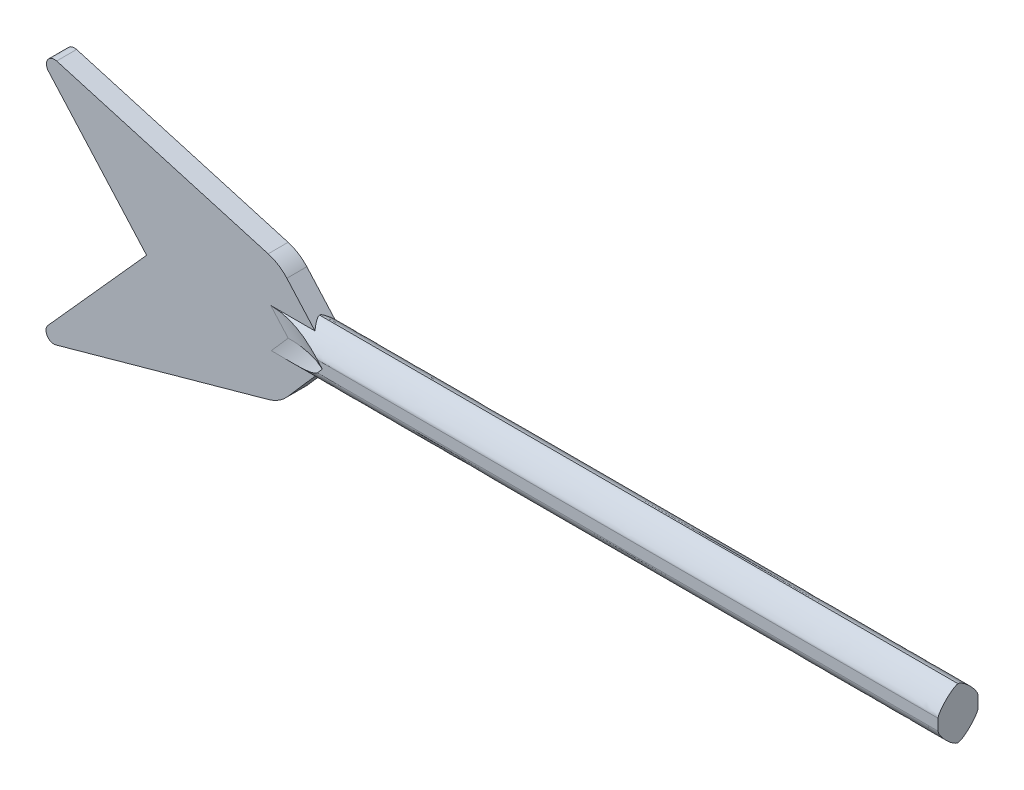
from build123d import *

# Parameters (mm, degrees)
BOSS_EXTRU_1_DEPTH = 5
BOSS_EXTRU_3_START = 7.5
BOSS_EXTRU_3_DEPTH = 10
CONG_8_R           = 15
CONG_9_SIZE        = 5


with BuildPart() as part:
    # Esquisse1 → Boss.-Extru.1 (new body)
    with BuildSketch(Plane.XY):
        with BuildLine():
            Line((-12.455060077, 7.329105625), (-23.832360657, 20.114357067))
            ThreePointArc((-23.832360657, 20.114357067), (-25.968224675, 21.924872738), (-28.522312132, 23.072269514))
            Line((-28.522312132, 23.072269514), (-81.529598126, 38.415853733))
            ThreePointArc((-81.529598126, 38.415853733), (-83.77734848, 37.561631676), (-83.579778581, 35.165166965))
            Line((-83.579778581, 35.165166965), (-58.983064004, 7.524587521))
            Line((-58.983064004, 7.524587521), (-83.683817787, -20.023057796))
            ThreePointArc((-83.683817787, -20.023057796), (-83.894250032, -22.412614831), (-81.659847534, -23.285374839))
            Line((-81.659847534, -23.285374839), (-28.501505769, -8.530440884))
            ThreePointArc((-28.501505769, -8.530440884), (-25.85033223, -7.358585076), (-23.646623539, -5.475599369))
            Line((-23.646623539, -5.475599369), (-12.455060077, 7.329105625))
        make_face()
    extrude(amount=BOSS_EXTRU_1_DEPTH)

    # Esquisse2 → Boss.-Extru.3 (add)
    with BuildSketch(Plane.XY.offset(BOSS_EXTRU_3_START)):
        Polygon((-18.143710367, 13.721731346), (141.856289633, 13.721731346), (141.856289633, 0.926753128), (-18.050841808, 0.926753128), (-12.455060077, 7.329105625), align=None)
    extrude(amount=-BOSS_EXTRU_3_DEPTH)

    # Congé8
    # the kernel refuses this fillet: 15 mm, written as the material it adds along each edge
    with BuildSketch(Plane(origin=(-31.692252861, -14.680918207, 5), x_dir=(-0.7529423951680033, 0.6580864301584334, 0), z_dir=(0.6580864301584333, 0.7529423951680033, 0))) as cong_8_piece_1_section:
        with BuildLine():
            CenterArc((8.291561976, 15), CONG_8_R, 236.442690238, 33.557309762)
            Line((0, 2.5), (0, 0))
            Line((0, 0), (8.291561976, 0))
        make_face()
    cong_8_piece_1 = extrude(amount=49.960920527, mode=Mode.PRIVATE)
    cong_8_piece_1 = split(cong_8_piece_1, bisect_by=Plane(origin=(-31.692252861, 0.926753128, 5), z_dir=(0, 1, 0)), keep=Keep.TOP, mode=Mode.PRIVATE)
    cong_8_piece_1 = split(cong_8_piece_1, bisect_by=Plane(origin=(-31.692252861, 13.721731346, 5), z_dir=(0, -1, 0)), keep=Keep.TOP, mode=Mode.PRIVATE)
    add(cong_8_piece_1)
    with BuildSketch(Plane(origin=(1.325019877, -8.156271234, 5), x_dir=(-0.7470426876655595, -0.6647760696696423, 0), z_dir=(-0.6647760696696423, 0.7470426876655596, 0))) as cong_8_piece_2_section:
        with BuildLine():
            CenterArc((8.291561976, 15), CONG_8_R, 236.442690238, 33.557309762)
            Line((0, 2.5), (0, 0))
            Line((0, 0), (8.291561976, 0))
        make_face()
    cong_8_piece_2 = extrude(amount=50.015052761, mode=Mode.PRIVATE)
    cong_8_piece_2 = split(cong_8_piece_2, bisect_by=Plane(origin=(-14.160236459, 5.378146708, 5), z_dir=(-0.752942395168003, 0.6580864301584336, 0)), keep=Keep.TOP, mode=Mode.PRIVATE)
    cong_8_piece_2 = split(cong_8_piece_2, bisect_by=Plane(origin=(1.325019877, 13.721731346, 5), z_dir=(0, -1, 0)), keep=Keep.TOP, mode=Mode.PRIVATE)
    add(cong_8_piece_2)
    with BuildSketch(Plane(origin=(1.325019877, -8.156271234, 0), x_dir=(-0.7470426876655595, -0.6647760696696423, 0), z_dir=(-0.6647760696696423, 0.7470426876655596, 0))) as cong_8_piece_3_section:
        with BuildLine():
            CenterArc((8.291561976, -15), CONG_8_R, 90, 33.557309762)
            Line((0, -2.5), (0, 0))
            Line((0, 0), (8.291561976, 0))
        make_face()
    cong_8_piece_3 = extrude(amount=50.015052761, mode=Mode.PRIVATE)
    cong_8_piece_3 = split(cong_8_piece_3, bisect_by=Plane(origin=(-14.160236459, 5.378146708, 0), z_dir=(-0.752942395168003, 0.6580864301584336, 0)), keep=Keep.TOP, mode=Mode.PRIVATE)
    cong_8_piece_3 = split(cong_8_piece_3, bisect_by=Plane(origin=(1.325019877, 13.721731346, 0), z_dir=(0, -1, 0)), keep=Keep.TOP, mode=Mode.PRIVATE)
    add(cong_8_piece_3)
    with BuildSketch(Plane(origin=(-31.692252861, -14.680918207, 0), x_dir=(-0.7529423951680033, 0.6580864301584334, 0), z_dir=(0.6580864301584333, 0.7529423951680033, 0))) as cong_8_piece_4_section:
        with BuildLine():
            CenterArc((8.291561976, -15), CONG_8_R, 90, 33.557309762)
            Line((0, -2.5), (0, 0))
            Line((0, 0), (8.291561976, 0))
        make_face()
    cong_8_piece_4 = extrude(amount=49.960920527, mode=Mode.PRIVATE)
    cong_8_piece_4 = split(cong_8_piece_4, bisect_by=Plane(origin=(-31.692252861, 0.926753128, 0), z_dir=(0, 1, 0)), keep=Keep.TOP, mode=Mode.PRIVATE)
    cong_8_piece_4 = split(cong_8_piece_4, bisect_by=Plane(origin=(-31.692252861, 13.721731346, 0), z_dir=(0, -1, 0)), keep=Keep.TOP, mode=Mode.PRIVATE)
    add(cong_8_piece_4)

    # Congé9
    # a fillet whose section is not a circle: 5 mm, written as the material it takes off along each edge
    with BuildSketch(Plane(origin=(154.356289633, 0.926753128, 7.5), x_dir=(0, 1, 0), z_dir=(-1, 0, 0))) as cong_9_piece_1_section:
        with BuildLine():
            Bezier((CONG_9_SIZE, 0), (0, 0), (0, CONG_9_SIZE), weights=[1, 0.25, 1])
            Line((0, CONG_9_SIZE), (0, 0))
            Line((0, 0), (CONG_9_SIZE, 0))
        make_face()
    cong_9_piece_1 = extrude(amount=184.907131441, mode=Mode.PRIVATE)
    cong_9_piece_1 = split(cong_9_piece_1, bisect_by=Plane(origin=(154.356289633, 0.926753128, 5), z_dir=(0, 0, 1)), keep=Keep.TOP, mode=Mode.PRIVATE)
    cong_9_piece_1 = split(cong_9_piece_1, bisect_by=Plane(origin=(56.614850684, 86.354688982, 7.5), z_dir=(0.7529423951680033, -0.6580864301584333, 0)), keep=Keep.TOP, mode=Mode.PRIVATE)
    add(cong_9_piece_1, mode=Mode.SUBTRACT)
    with BuildSketch(Plane(origin=(154.356289633, 0.926753128, 7.5), x_dir=(0, 1, 0), z_dir=(-1, 0, 0))) as cong_9_piece_2_section:
        with BuildLine():
            Bezier((CONG_9_SIZE, 0), (0, 0), (0, CONG_9_SIZE), weights=[1, 0.25, 1])
            Line((0, CONG_9_SIZE), (0, 0))
            Line((0, 0), (CONG_9_SIZE, 0))
        make_face()
    cong_9_piece_2 = extrude(amount=184.907131441, mode=Mode.PRIVATE)
    cong_9_piece_2 = split(cong_9_piece_2, bisect_by=Plane(origin=(154.356289633, 0.926753128, 5), z_dir=(0, 0, -1)), keep=Keep.TOP, mode=Mode.PRIVATE)
    cong_9_piece_2 = split(cong_9_piece_2, bisect_by=Plane(origin=(56.614850684, 86.354688982, 7.5), z_dir=(0.7529423951680033, -0.6580864301584333, 0)), keep=Keep.TOP, mode=Mode.PRIVATE)
    add(cong_9_piece_2, mode=Mode.SUBTRACT)
    with BuildSketch(Plane(origin=(154.356289633, 0.926753128, 7.5), x_dir=(0, 1, 0), z_dir=(-1, 0, 0))) as cong_9_piece_3_section:
        with BuildLine():
            Bezier((CONG_9_SIZE, 0), (0, 0), (0, CONG_9_SIZE), weights=[1, 0.25, 1])
            Line((0, CONG_9_SIZE), (0, 0))
            Line((0, 0), (CONG_9_SIZE, 0))
        make_face()
    cong_9_piece_3 = extrude(amount=184.907131441, mode=Mode.PRIVATE)
    cong_9_piece_3 = split(cong_9_piece_3, bisect_by=Plane(origin=(154.356289633, 0.926753128, 5), z_dir=(0, 0, 1)), keep=Keep.TOP, mode=Mode.PRIVATE)
    cong_9_piece_3 = split(cong_9_piece_3, bisect_by=Plane(origin=(56.614850684, 86.354688982, 7.5), z_dir=(-0.7529423951680033, 0.6580864301584333, 0)), keep=Keep.TOP, mode=Mode.PRIVATE)
    add(cong_9_piece_3, mode=Mode.SUBTRACT)
    with BuildSketch(Plane(origin=(154.356289633, 13.721731346, 7.5), x_dir=(0, -1, 0), z_dir=(-1, 0, 0))) as cong_9_piece_4_section:
        with BuildLine():
            Bezier((CONG_9_SIZE, 0), (0, 0), (0, -CONG_9_SIZE), weights=[1, 0.25, 1])
            Line((0, -CONG_9_SIZE), (0, 0))
            Line((0, 0), (CONG_9_SIZE, 0))
        make_face()
    cong_9_piece_4 = extrude(amount=185, mode=Mode.PRIVATE)
    cong_9_piece_4 = split(cong_9_piece_4, bisect_by=Plane(origin=(154.356289633, 13.721731346, 5), z_dir=(0, 0, 1)), keep=Keep.TOP, mode=Mode.PRIVATE)
    cong_9_piece_4 = split(cong_9_piece_4, bisect_by=Plane(origin=(58.088735567, -71.944546211, 7.5), z_dir=(0.7470426876655596, 0.6647760696696423, 0)), keep=Keep.TOP, mode=Mode.PRIVATE)
    add(cong_9_piece_4, mode=Mode.SUBTRACT)
    with BuildSketch(Plane(origin=(154.356289633, 13.721731346, 7.5), x_dir=(0, -1, 0), z_dir=(-1, 0, 0))) as cong_9_piece_5_section:
        with BuildLine():
            Bezier((CONG_9_SIZE, 0), (0, 0), (0, -CONG_9_SIZE), weights=[1, 0.25, 1])
            Line((0, -CONG_9_SIZE), (0, 0))
            Line((0, 0), (CONG_9_SIZE, 0))
        make_face()
    cong_9_piece_5 = extrude(amount=185, mode=Mode.PRIVATE)
    cong_9_piece_5 = split(cong_9_piece_5, bisect_by=Plane(origin=(154.356289633, 13.721731346, 5), z_dir=(0, 0, -1)), keep=Keep.TOP, mode=Mode.PRIVATE)
    cong_9_piece_5 = split(cong_9_piece_5, bisect_by=Plane(origin=(58.088735567, -71.944546211, 7.5), z_dir=(0.7470426876655596, 0.6647760696696423, 0)), keep=Keep.TOP, mode=Mode.PRIVATE)
    add(cong_9_piece_5, mode=Mode.SUBTRACT)
    with BuildSketch(Plane(origin=(154.356289633, 13.721731346, 7.5), x_dir=(0, -1, 0), z_dir=(-1, 0, 0))) as cong_9_piece_6_section:
        with BuildLine():
            Bezier((CONG_9_SIZE, 0), (0, 0), (0, -CONG_9_SIZE), weights=[1, 0.25, 1])
            Line((0, -CONG_9_SIZE), (0, 0))
            Line((0, 0), (CONG_9_SIZE, 0))
        make_face()
    cong_9_piece_6 = extrude(amount=185, mode=Mode.PRIVATE)
    cong_9_piece_6 = split(cong_9_piece_6, bisect_by=Plane(origin=(154.356289633, 13.721731346, 5), z_dir=(0, 0, 1)), keep=Keep.TOP, mode=Mode.PRIVATE)
    cong_9_piece_6 = split(cong_9_piece_6, bisect_by=Plane(origin=(58.088735567, -71.944546211, 7.5), z_dir=(-0.7470426876655596, -0.6647760696696423, 0)), keep=Keep.TOP, mode=Mode.PRIVATE)
    add(cong_9_piece_6, mode=Mode.SUBTRACT)
    with BuildSketch(Plane(origin=(-30.643710367, 13.721731346, -2.5), x_dir=(0, 0, 1), z_dir=(1, 0, 0))) as cong_9_piece_7_section:
        with BuildLine():
            Bezier((CONG_9_SIZE, 0), (0, 0), (0, CONG_9_SIZE), weights=[1, 0.25, 1])
            Line((0, CONG_9_SIZE), (0, 0))
            Line((0, 0), (CONG_9_SIZE, 0))
        make_face()
    cong_9_piece_7 = extrude(amount=185, mode=Mode.PRIVATE)
    cong_9_piece_7 = split(cong_9_piece_7, bisect_by=Plane(origin=(-30.643710367, 13.721731346, 0), z_dir=(0, 0, -1)), keep=Keep.TOP, mode=Mode.PRIVATE)
    cong_9_piece_7 = split(cong_9_piece_7, bisect_by=Plane(origin=(-23.667800652, 19.929432618, -2.5), z_dir=(-0.7470426876655596, -0.6647760696696423, 0)), keep=Keep.TOP, mode=Mode.PRIVATE)
    add(cong_9_piece_7, mode=Mode.SUBTRACT)
    with BuildSketch(Plane(origin=(-30.643710367, 13.721731346, -2.5), x_dir=(0, 0, 1), z_dir=(1, 0, 0))) as cong_9_piece_8_section:
        with BuildLine():
            Bezier((CONG_9_SIZE, 0), (0, 0), (0, CONG_9_SIZE), weights=[1, 0.25, 1])
            Line((0, CONG_9_SIZE), (0, 0))
            Line((0, 0), (CONG_9_SIZE, 0))
        make_face()
    cong_9_piece_8 = extrude(amount=185, mode=Mode.PRIVATE)
    cong_9_piece_8 = split(cong_9_piece_8, bisect_by=Plane(origin=(-30.643710367, 13.721731346, 0), z_dir=(0, 0, 1)), keep=Keep.TOP, mode=Mode.PRIVATE)
    cong_9_piece_8 = split(cong_9_piece_8, bisect_by=Plane(origin=(-23.667800652, 19.929432618, -2.5), z_dir=(0.7470426876655596, 0.6647760696696423, 0)), keep=Keep.TOP, mode=Mode.PRIVATE)
    add(cong_9_piece_8, mode=Mode.SUBTRACT)
    with BuildSketch(Plane(origin=(-30.643710367, 13.721731346, -2.5), x_dir=(0, 0, 1), z_dir=(1, 0, 0))) as cong_9_piece_9_section:
        with BuildLine():
            Bezier((CONG_9_SIZE, 0), (0, 0), (0, CONG_9_SIZE), weights=[1, 0.25, 1])
            Line((0, CONG_9_SIZE), (0, 0))
            Line((0, 0), (CONG_9_SIZE, 0))
        make_face()
    cong_9_piece_9 = extrude(amount=185, mode=Mode.PRIVATE)
    cong_9_piece_9 = split(cong_9_piece_9, bisect_by=Plane(origin=(-30.643710367, 13.721731346, 0), z_dir=(0, 0, -1)), keep=Keep.TOP, mode=Mode.PRIVATE)
    cong_9_piece_9 = split(cong_9_piece_9, bisect_by=Plane(origin=(-23.667800652, 19.929432618, -2.5), z_dir=(0.7470426876655596, 0.6647760696696423, 0)), keep=Keep.TOP, mode=Mode.PRIVATE)
    add(cong_9_piece_9, mode=Mode.SUBTRACT)
    with BuildSketch(Plane(origin=(154.356289633, 0.926753128, -2.5), x_dir=(0, 1, 0), z_dir=(-1, 0, 0))) as cong_9_piece_10_section:
        with BuildLine():
            Bezier((CONG_9_SIZE, 0), (0, 0), (0, -CONG_9_SIZE), weights=[1, 0.25, 1])
            Line((0, -CONG_9_SIZE), (0, 0))
            Line((0, 0), (CONG_9_SIZE, 0))
        make_face()
    cong_9_piece_10 = extrude(amount=184.907131441, mode=Mode.PRIVATE)
    cong_9_piece_10 = split(cong_9_piece_10, bisect_by=Plane(origin=(154.356289633, 0.926753128, 0), z_dir=(0, 0, -1)), keep=Keep.TOP, mode=Mode.PRIVATE)
    cong_9_piece_10 = split(cong_9_piece_10, bisect_by=Plane(origin=(56.614850684, 86.354688982, -2.5), z_dir=(0.7529423951680033, -0.6580864301584333, 0)), keep=Keep.TOP, mode=Mode.PRIVATE)
    add(cong_9_piece_10, mode=Mode.SUBTRACT)
    with BuildSketch(Plane(origin=(154.356289633, 0.926753128, -2.5), x_dir=(0, 1, 0), z_dir=(-1, 0, 0))) as cong_9_piece_11_section:
        with BuildLine():
            Bezier((CONG_9_SIZE, 0), (0, 0), (0, -CONG_9_SIZE), weights=[1, 0.25, 1])
            Line((0, -CONG_9_SIZE), (0, 0))
            Line((0, 0), (CONG_9_SIZE, 0))
        make_face()
    cong_9_piece_11 = extrude(amount=184.907131441, mode=Mode.PRIVATE)
    cong_9_piece_11 = split(cong_9_piece_11, bisect_by=Plane(origin=(154.356289633, 0.926753128, 0), z_dir=(0, 0, 1)), keep=Keep.TOP, mode=Mode.PRIVATE)
    cong_9_piece_11 = split(cong_9_piece_11, bisect_by=Plane(origin=(56.614850684, 86.354688982, -2.5), z_dir=(0.7529423951680033, -0.6580864301584333, 0)), keep=Keep.TOP, mode=Mode.PRIVATE)
    add(cong_9_piece_11, mode=Mode.SUBTRACT)
    with BuildSketch(Plane(origin=(154.356289633, 0.926753128, -2.5), x_dir=(0, 1, 0), z_dir=(-1, 0, 0))) as cong_9_piece_12_section:
        with BuildLine():
            Bezier((CONG_9_SIZE, 0), (0, 0), (0, -CONG_9_SIZE), weights=[1, 0.25, 1])
            Line((0, -CONG_9_SIZE), (0, 0))
            Line((0, 0), (CONG_9_SIZE, 0))
        make_face()
    cong_9_piece_12 = extrude(amount=184.907131441, mode=Mode.PRIVATE)
    cong_9_piece_12 = split(cong_9_piece_12, bisect_by=Plane(origin=(154.356289633, 0.926753128, 0), z_dir=(0, 0, -1)), keep=Keep.TOP, mode=Mode.PRIVATE)
    cong_9_piece_12 = split(cong_9_piece_12, bisect_by=Plane(origin=(56.614850684, 86.354688982, -2.5), z_dir=(-0.7529423951680033, 0.6580864301584333, 0)), keep=Keep.TOP, mode=Mode.PRIVATE)
    add(cong_9_piece_12, mode=Mode.SUBTRACT)


solid = part.part
